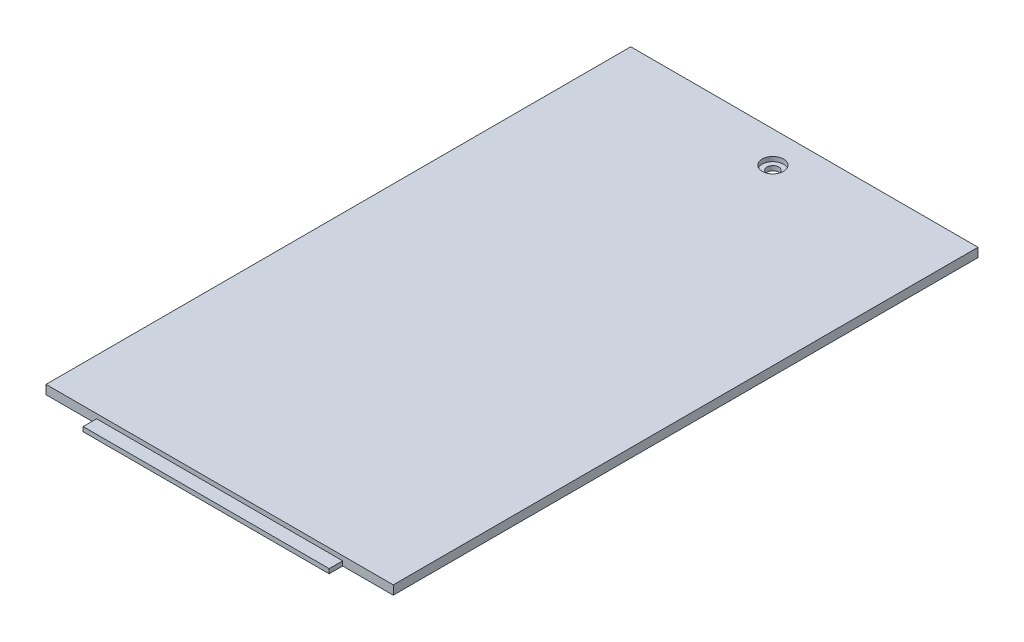
from build123d import *

# Parameters (mm, degrees)
SKETCH_1_W          = 77.2
SKETCH_1_H          = 130
EXTRUDE_1_DEPTH     = 2
SKETCH_3_R          = 1.3
CUT_EXTRUDE_1_DEPTH = 76.623805776
SKETCH_5_R          = 2.375
CUT_EXTRUDE_2_DEPTH = 1
SKETCH_6_W          = 54.7
SKETCH_6_H          = 1
EXTRUDE_2_DEPTH     = 3


with BuildPart() as part:
    # Эскиз1 → Бобышка-Вытянуть1 (new body)
    with BuildSketch(Plane(origin=(0, 0, 0), x_dir=(1, 0, 0), z_dir=(0, 1, 0))):
        Rectangle(SKETCH_1_W, SKETCH_1_H)
    extrude(amount=EXTRUDE_1_DEPTH)

    # Эскиз3 → Вырез-Вытянуть1 (cut, through all)
    with BuildSketch(Plane(origin=(0, 2, 0), x_dir=(1, 0, 0), z_dir=(0, 1, 0))):
        with Locations((0, 58)):
            Circle(SKETCH_3_R)
    extrude(amount=-CUT_EXTRUDE_1_DEPTH, mode=Mode.SUBTRACT)

    # Эскиз5 → Вырез-Вытянуть2 (cut)
    with BuildSketch(Plane(origin=(0, 2, 0), x_dir=(1, 0, 0), z_dir=(0, 1, 0))):
        with Locations((0, 58)):
            Circle(SKETCH_5_R)
    extrude(amount=-CUT_EXTRUDE_2_DEPTH, mode=Mode.SUBTRACT)

    # Эскиз6 → Бобышка-Вытянуть2 (add)
    with BuildSketch(Plane.XY.offset(65)):
        with Locations((0, 0.5)):
            Rectangle(SKETCH_6_W, SKETCH_6_H)
    extrude(amount=EXTRUDE_2_DEPTH)


solid = part.part
